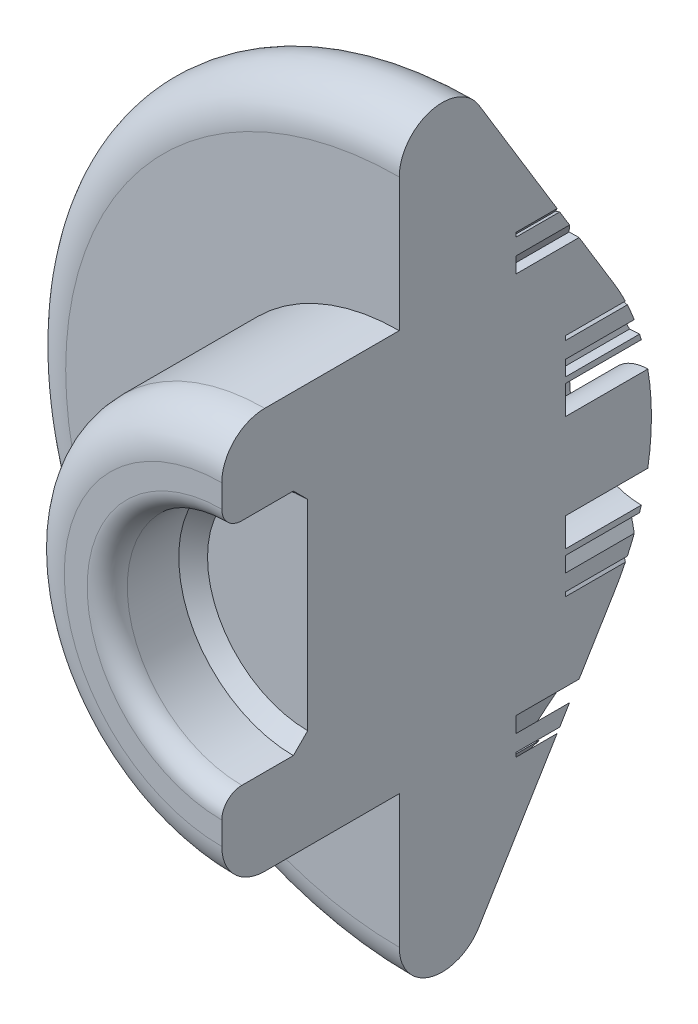
from build123d import *

# Parameters (mm, degrees)
REDONDEO3_R           = 0.7
REDONDEO5_R           = 1.5
CROQUIS2_R            = 2.5
CROQUIS2_R_2          = 1.5
CORTAR_EXTRUIR1_DEPTH = 3
CORTAR_EXTRUIR3_DEPTH = 3


# Read off the part's stored shape, not the designer's step: Sólido-Eliminar/Conservar 1
with BuildPart() as part:
    # Croquis1 → Revolución1 (revolve)
    with BuildSketch(Plane(origin=(0, 0, 0), x_dir=(0, 0, -1), z_dir=(1, 0, 0)), mode=Mode.PRIVATE) as revoluci_n1_sk:
        with BuildLine():
            Line((10.5, 4), (12.997954185, 4))
            Line((12.997954185, 4), (13.5, 3.497954185))
            Line((13.5, 3.497954185), (13.5, 0))
            Line((13.5, 0), (25.5, 0))
            ThreePointArc((25.5, 0), (25.166294504, 2.428032035), (24.189924541, 4.676009041))
            Line((24.189924541, 4.676009041), (16.696080767, 17))
            Line((16.696080767, 17), (16.696080767, 7))
            Line((16.696080767, 7), (10.5, 7))
            Line((10.5, 7), (10.5, 4))
        make_face()
    revolve(revoluci_n1_sk.sketch.rotate(Axis((0, 0, 43.421280629), (0, 0, -1)), 90), axis=Axis((0, 0, 43.421280629), (0, 0, -1)))

    # Redondeo3
    redondeo3_edges = [part.edges().sort_by_distance(p)[0] for p in [
        (-4, 0, -10.5),
    ]]
    fillet(redondeo3_edges, radius=REDONDEO3_R)

    # Redondeo5
    redondeo5_edges = [part.edges().sort_by_distance(p)[0] for p in [
        (-17, 0, -16.696080767),
        (-7, 0, -10.5),
    ]]
    fillet(redondeo5_edges, radius=REDONDEO5_R)

    # Croquis2 → Cortar-Extruir1 (cut)
    # profile 1 of 5: a face of its own
    with BuildSketch(Plane(origin=(0, 0, -25.5), x_dir=(-1, 0, 0), z_dir=(0, 0, -1))):
        Circle(CROQUIS2_R)
        Circle(CROQUIS2_R_2, mode=Mode.SUBTRACT)
    # profile 2 of 5: a face of its own
    with BuildSketch(Plane(origin=(0, 0, -25.5), x_dir=(-1, 0, 0), z_dir=(0, 0, -1))):
        with BuildLine():
            Line((-0.35, 2.677218706), (0.557333453, 4.114836877))
            Line((0.557333453, 4.114836877), (-0.216020438, 3.677218706))
            Line((-0.216020438, 3.677218706), (1.01365522, 5.207218706))
            Line((1.01365522, 5.207218706), (0.420313019, 4.267101787))
            Line((0.420313019, 4.267101787), (0.85, 4.510248984))
            Line((0.85, 4.510248984), (0.35, 2.677218706))
            ThreePointArc((0.35, 2.677218706), (0, 2.7), (-0.35, 2.677218706))
        make_face()
    # profile 3 of 5: a face of its own
    with BuildSketch(Plane(origin=(0, 0, -25.5), x_dir=(-1, 0, 0), z_dir=(0, 0, -1))):
        with BuildLine():
            Line((4.510248984, -0.85), (2.677218706, -0.35))
            ThreePointArc((2.677218706, -0.35), (2.7, 0), (2.677218706, 0.35))
            Line((2.677218706, 0.35), (4.114836877, -0.557333453))
            Line((4.114836877, -0.557333453), (3.677218706, 0.216020438))
            Line((3.677218706, 0.216020438), (5.207218706, -1.01365522))
            Line((5.207218706, -1.01365522), (4.267101787, -0.420313019))
            Line((4.267101787, -0.420313019), (4.510248984, -0.85))
        make_face()
    # profile 4 of 5: a face of its own
    with BuildSketch(Plane(origin=(0, 0, -25.5), x_dir=(-1, 0, 0), z_dir=(0, 0, -1))):
        with BuildLine():
            Line((-0.85, -4.510248984), (-0.35, -2.677218706))
            ThreePointArc((-0.35, -2.677218706), (0, -2.7), (0.35, -2.677218706))
            Line((0.35, -2.677218706), (-0.557333453, -4.114836877))
            Line((-0.557333453, -4.114836877), (0.216020438, -3.677218706))
            Line((0.216020438, -3.677218706), (-1.01365522, -5.207218706))
            Line((-1.01365522, -5.207218706), (-0.420313019, -4.267101787))
            Line((-0.420313019, -4.267101787), (-0.85, -4.510248984))
        make_face()
    # profile 5 of 5: a face of its own
    with BuildSketch(Plane(origin=(0, 0, -25.5), x_dir=(-1, 0, 0), z_dir=(0, 0, -1))):
        with BuildLine():
            Line((-4.510248984, 0.85), (-2.677218706, 0.35))
            ThreePointArc((-2.677218706, 0.35), (-2.7, 0), (-2.677218706, -0.35))
            Line((-2.677218706, -0.35), (-4.114836877, 0.557333453))
            Line((-4.114836877, 0.557333453), (-3.677218706, -0.216020438))
            Line((-3.677218706, -0.216020438), (-5.207218706, 1.01365522))
            Line((-5.207218706, 1.01365522), (-4.267101787, 0.420313019))
            Line((-4.267101787, 0.420313019), (-4.510248984, 0.85))
        make_face()
    extrude(amount=-CORTAR_EXTRUIR1_DEPTH, mode=Mode.SUBTRACT)

    # Croquis3 → Cortar-Extruir3 (cut)
    with BuildSketch(Plane.XY.offset(-23.77)):
        with BuildLine():
            Line((-0.35, 6.666828085), (0.557333453, 8.104446256))
            Line((0.557333453, 8.104446256), (-0.216020438, 7.666828085))
            Line((-0.216020438, 7.666828085), (1.01365522, 9.196828085))
            Line((1.01365522, 9.196828085), (0.420313019, 8.256711166))
            Line((0.420313019, 8.256711166), (0.85, 8.499858363))
            Line((0.85, 8.499858363), (0.35, 6.666828085))
            ThreePointArc((0.35, 6.666828085), (0, 6.676009041), (-0.35, 6.666828085))
        make_face()
        with BuildLine():
            Line((3.63550728, 5.599302058), (5.214566222, 6.229042367))
            Line((5.214566222, 6.229042367), (4.331684274, 6.329567842))
            Line((4.331684274, 6.329567842), (6.225824216, 6.844578626))
            Line((6.225824216, 6.844578626), (5.193213431, 6.432765857))
            Line((5.193213431, 6.432765857), (5.683755838, 6.376912401))
            Line((5.683755838, 6.376912401), (4.201819176, 5.187852381))
            ThreePointArc((4.201819176, 5.187852381), (3.924059658, 5.401004769), (3.63550728, 5.599302058))
        make_face()
        with BuildLine():
            Line((6.232374345, 2.393032958), (7.880011931, 1.974356011))
            Line((7.880011931, 1.974356011), (7.224832823, 2.574627817))
            Line((7.224832823, 2.574627817), (9.059939969, 1.87793277))
            Line((9.059939969, 1.87793277), (7.982482824, 2.151722632))
            Line((7.982482824, 2.151722632), (8.346510129, 1.818202645))
            Line((8.346510129, 1.818202645), (6.448686241, 1.727293396))
            ThreePointArc((6.448686241, 1.727293396), (6.349261901, 2.063000248), (6.232374345, 2.393032958))
        make_face()
        with BuildLine():
            Line((6.448686241, -1.727293396), (7.535560914, -3.034467235))
            Line((7.535560914, -3.034467235), (7.358340796, -2.163732526))
            Line((7.358340796, -2.163732526), (8.43346659, -3.806019575))
            Line((8.43346659, -3.806019575), (7.722715092, -2.951205504))
            Line((7.722715092, -2.951205504), (7.821181238, -3.434998723))
            Line((7.821181238, -3.434998723), (6.232374345, -2.393032958))
            ThreePointArc((6.232374345, -2.393032958), (6.349261901, -2.063000248), (6.448686241, -1.727293396))
        make_face()
        with BuildLine():
            Line((4.201819176, -5.187852381), (4.312781752, -6.884227135))
            Line((4.312781752, -6.884227135), (4.681212686, -6.075620586))
            Line((4.681212686, -6.075620586), (4.585695617, -8.036201804))
            Line((4.585695617, -8.036201804), (4.513132681, -6.926873445))
            Line((4.513132681, -6.926873445), (4.308426947, -7.37614733))
            Line((4.308426947, -7.37614733), (3.63550728, -5.599302058))
            ThreePointArc((3.63550728, -5.599302058), (3.924059658, -5.401004769), (4.201819176, -5.187852381))
        make_face()
        with BuildLine():
            Line((0.35, -6.666828085), (-0.557333453, -8.104446256))
            Line((-0.557333453, -8.104446256), (0.216020438, -7.666828085))
            Line((0.216020438, -7.666828085), (-1.01365522, -9.196828085))
            Line((-1.01365522, -9.196828085), (-0.420313019, -8.256711166))
            Line((-0.420313019, -8.256711166), (-0.85, -8.499858363))
            Line((-0.85, -8.499858363), (-0.35, -6.666828085))
            ThreePointArc((-0.35, -6.666828085), (0, -6.676009041), (0.35, -6.666828085))
        make_face()
        with BuildLine():
            Line((-3.63550728, -5.599302058), (-5.214566222, -6.229042367))
            Line((-5.214566222, -6.229042367), (-4.331684274, -6.329567842))
            Line((-4.331684274, -6.329567842), (-6.225824216, -6.844578626))
            Line((-6.225824216, -6.844578626), (-5.193213431, -6.432765857))
            Line((-5.193213431, -6.432765857), (-5.683755838, -6.376912401))
            Line((-5.683755838, -6.376912401), (-4.201819176, -5.187852381))
            ThreePointArc((-4.201819176, -5.187852381), (-3.924059658, -5.401004769), (-3.63550728, -5.599302058))
        make_face()
        with BuildLine():
            Line((-6.232374345, -2.393032958), (-7.880011931, -1.974356011))
            Line((-7.880011931, -1.974356011), (-7.224832823, -2.574627817))
            Line((-7.224832823, -2.574627817), (-9.059939969, -1.87793277))
            Line((-9.059939969, -1.87793277), (-7.982482824, -2.151722632))
            Line((-7.982482824, -2.151722632), (-8.346510129, -1.818202645))
            Line((-8.346510129, -1.818202645), (-6.448686241, -1.727293396))
            ThreePointArc((-6.448686241, -1.727293396), (-6.349261901, -2.063000248), (-6.232374345, -2.393032958))
        make_face()
        with BuildLine():
            Line((-6.448686241, 1.727293396), (-7.535560914, 3.034467235))
            Line((-7.535560914, 3.034467235), (-7.358340796, 2.163732526))
            Line((-7.358340796, 2.163732526), (-8.43346659, 3.806019575))
            Line((-8.43346659, 3.806019575), (-7.722715092, 2.951205504))
            Line((-7.722715092, 2.951205504), (-7.821181238, 3.434998723))
            Line((-7.821181238, 3.434998723), (-6.232374345, 2.393032958))
            ThreePointArc((-6.232374345, 2.393032958), (-6.349261901, 2.063000248), (-6.448686241, 1.727293396))
        make_face()
        with BuildLine():
            Line((-4.201819176, 5.187852381), (-4.312781752, 6.884227135))
            Line((-4.312781752, 6.884227135), (-4.681212686, 6.075620586))
            Line((-4.681212686, 6.075620586), (-4.585695617, 8.036201804))
            Line((-4.585695617, 8.036201804), (-4.513132681, 6.926873445))
            Line((-4.513132681, 6.926873445), (-4.308426947, 7.37614733))
            Line((-4.308426947, 7.37614733), (-3.63550728, 5.599302058))
            ThreePointArc((-3.63550728, 5.599302058), (-3.924059658, 5.401004769), (-4.201819176, 5.187852381))
        make_face()
    extrude(amount=CORTAR_EXTRUIR3_DEPTH, mode=Mode.SUBTRACT)


with BuildPart() as body_2:
    # Partir1: the piece on the far side of the plane
    add(part.part)
    split(bisect_by=Plane(origin=(0, 0, 0), x_dir=(0, 0, 1), z_dir=(1, 0, 0)), keep=Keep.BOTTOM)


with BuildPart() as part_1:
    add(part.part)

    # Partir1
    split(bisect_by=Plane(origin=(0, 0, 0), x_dir=(0, 0, 1), z_dir=(1, 0, 0)), keep=Keep.TOP)


solid = body_2.part
